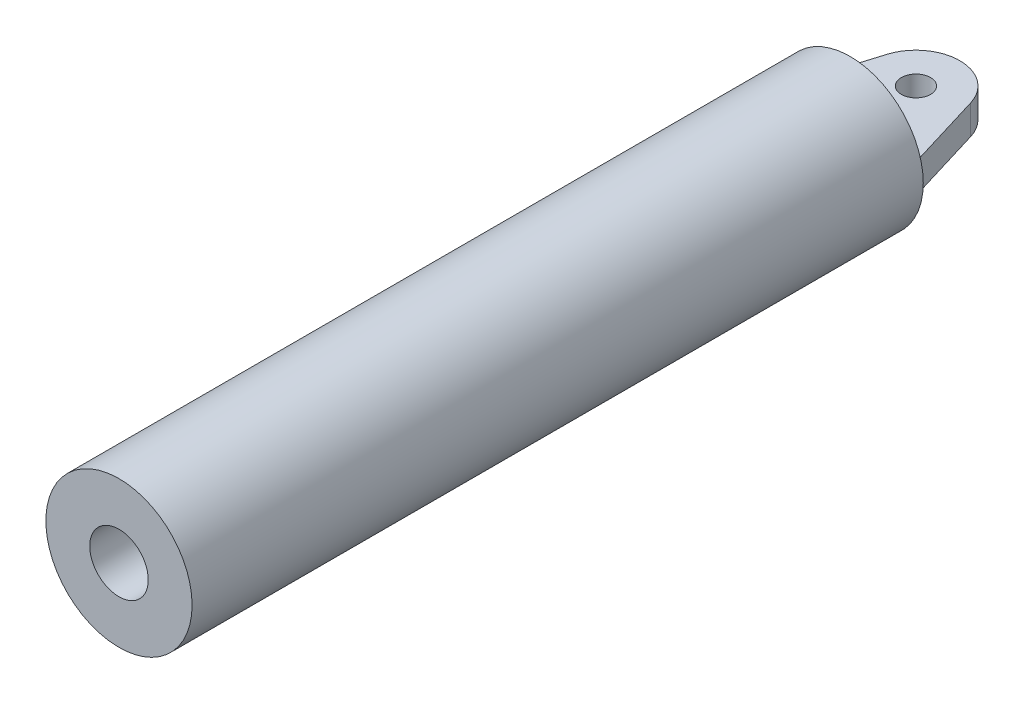
from build123d import *

# Parameters (mm, degrees)
SKETCH1_R           = 50
BOSS_EXTRUDE1_DEPTH = 500
SKETCH2_R           = 10
BOSS_EXTRUDE2_DEPTH = 10
SHELL1_START        = 30
SHELL1_OUTLINE_R    = 20
SHELL1_DEPTH        = 470


# Read off the part's stored shape, not the designer's step: Shell1
with BuildPart() as part:
    # Sketch1 → Boss-Extrude1 (new body)
    with BuildSketch(Plane.XY):
        Circle(SKETCH1_R)
    extrude(amount=BOSS_EXTRUDE1_DEPTH)

    # Sketch2 → Boss-Extrude2 (add, symmetric)
    with BuildSketch(Plane(origin=(0, 0, 0), x_dir=(1, 0, 0), z_dir=(0, 1, 0))):
        with BuildLine():
            Line((-45, 0), (-28.708286934, 53.708286934))
            ThreePointArc((-28.708286934, 53.708286934), (0, 75), (28.708286934, 53.708286934))
            Line((28.708286934, 53.708286934), (45, 0))
            Line((45, 0), (-45, 0))
        make_face()
        with Locations(Location((0, 45, 0), (0, 0, 270))):
            Circle(SKETCH2_R, mode=Mode.SUBTRACT)
    extrude(amount=BOSS_EXTRUDE2_DEPTH, both=True)

    # Shell1 outline → Shell1 (cut)
    with BuildSketch(Plane.XY.offset(SHELL1_START)):
        Circle(SHELL1_OUTLINE_R)
    extrude(amount=SHELL1_DEPTH, mode=Mode.SUBTRACT)


solid = part.part
